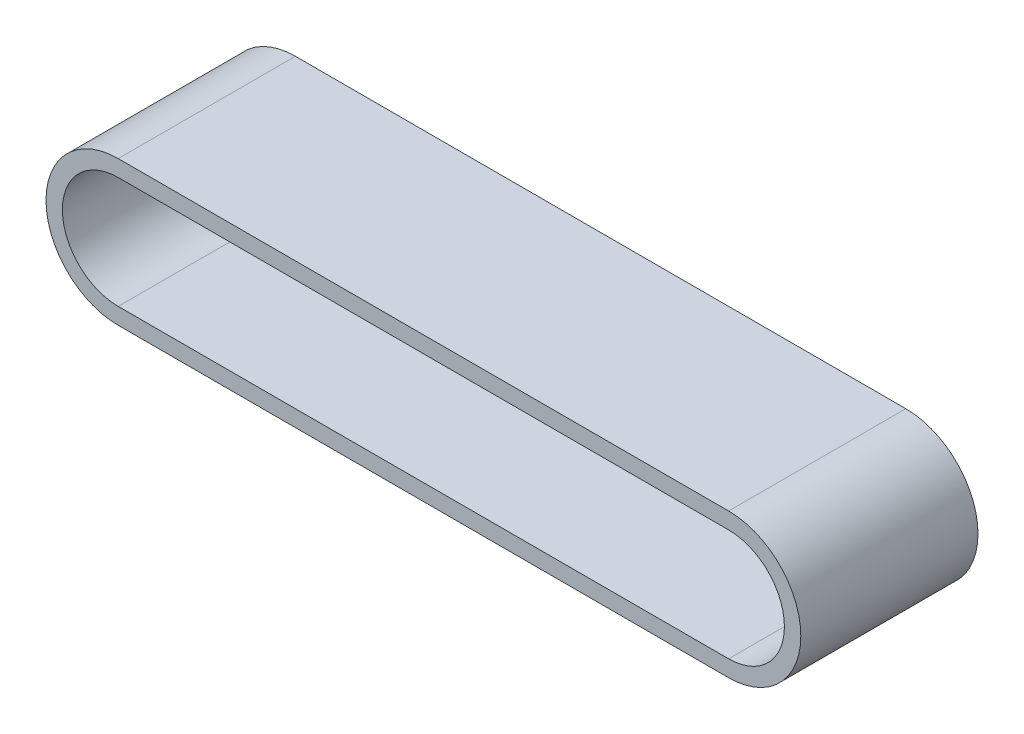
from build123d import *

# Parameters (mm, degrees)
BOSS_EXTRUDE1_DEPTH = 50.8


with BuildPart() as part:
    # Sketch1 → Boss-Extrude1 (new body)
    with BuildSketch(Plane.XY):
        with BuildLine():
            Line((87.5, -20.7), (-87.5, -20.7))
            ThreePointArc((-87.5, -20.7), (-108.2, 0), (-87.5, 20.7))
            Line((-87.5, 20.7), (87.5, 20.7))
            ThreePointArc((87.5, 20.7), (108.2, 0), (87.5, -20.7))
        make_face()
        with BuildLine():
            Line((87.5, -16), (-87.5, -16))
            ThreePointArc((-87.5, -16), (-103.5, 0), (-87.5, 16))
            Line((-87.5, 16), (87.5, 16))
            ThreePointArc((87.5, 16), (103.5, 0), (87.5, -16))
        make_face(mode=Mode.SUBTRACT)
    extrude(amount=BOSS_EXTRUDE1_DEPTH)


solid = part.part
